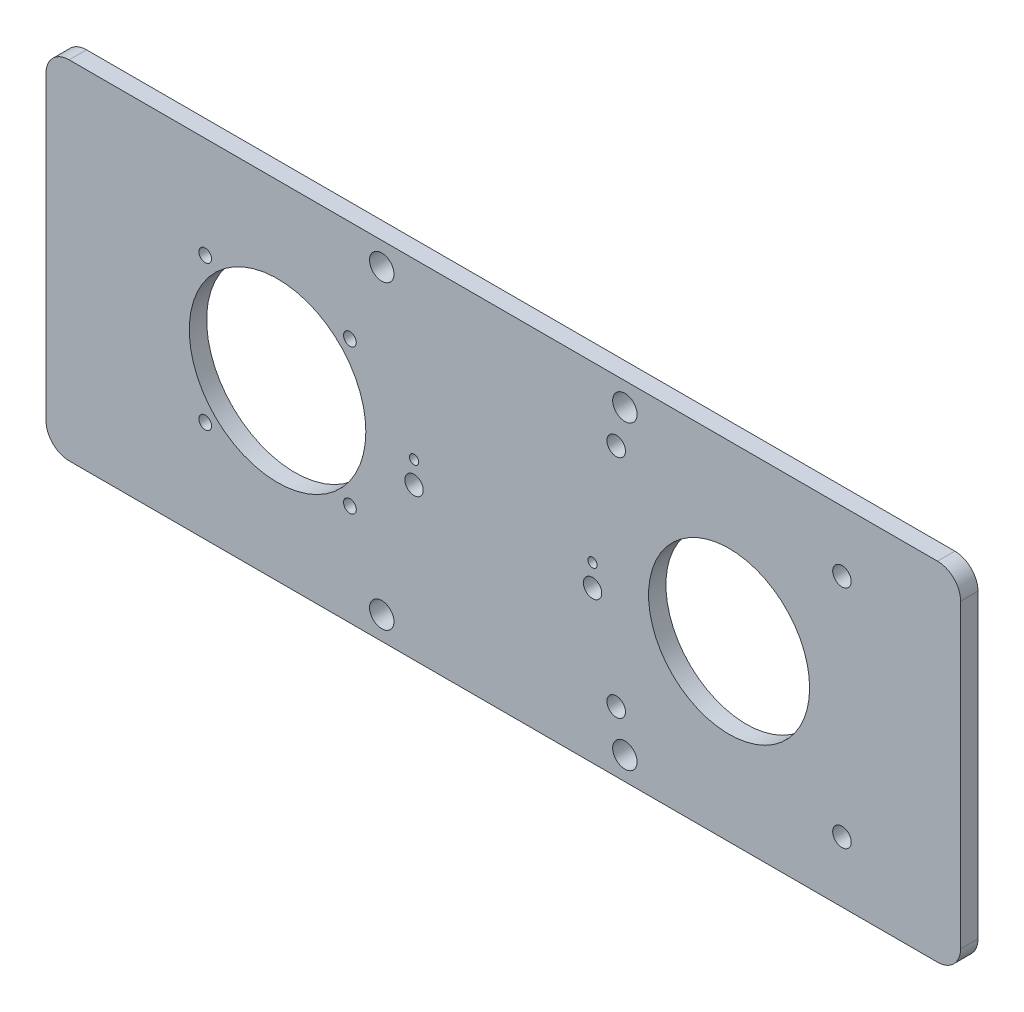
from build123d import *

# Parameters (mm, degrees)
SKETCH3_W             = 158
SKETCH3_H             = 60
SKETCH3_R             = 15.25
SKETCH3_R_2           = 13.91
BOSS_EXTRUDE2_DEPTH   = 3
FILLET1_R             = 4
EVK4_HOLES_D          = 2.2
FLIR_HOLES_D          = 3.2
VN_MOUNT_HOLES_D      = 3.175
VN_REF_HOLES_D        = 1.59
F_1_0MM_DOWEL_HOLE5_D = 4.22


with BuildPart() as part:
    # Sketch3 → Boss-Extrude2 (new body)
    with BuildSketch(Plane.XY):
        with Locations((0, -40)):
            Rectangle(SKETCH3_W, SKETCH3_H)
        with Locations((-39, -40)):
            Circle(SKETCH3_R, mode=Mode.SUBTRACT)
        with Locations((39, -40)):
            Circle(SKETCH3_R_2, mode=Mode.SUBTRACT)
    extrude(amount=-BOSS_EXTRUDE2_DEPTH)

    # Fillet1
    fillet1_edges = [part.edges().sort_by_distance(p)[0] for p in [
        (-79, -70, -1.5),
        (79, -70, -1.5),
        (-79, -10, -1.5),
        (79, -10, -1.5),
    ]]
    fillet(fillet1_edges, radius=FILLET1_R)

    # EVK4-Holes (through all)
    with Locations(Plane.XY):
        with Locations((-51.5, -27.5), (-26.5, -27.5), (-26.5, -52.5), (-51.5, -52.5)):
            Hole(EVK4_HOLES_D / 2)

    # FLIR-Holes (through all)
    with Locations(Plane.XY):
        with Locations((19.5, -20.5), (58.5, -20.5), (58.5, -59.5), (19.5, -59.5)):
            Hole(FLIR_HOLES_D / 2)

    # VN-Mount-Holes (through all)
    with Locations(Plane.XY):
        with Locations((-15.42, -43.81), (15.4159, -43.81)):
            Hole(VN_MOUNT_HOLES_D / 2)

    # VN-Ref-Holes (through all)
    with Locations(Plane.XY):
        with Locations((-15.42, -40), (15.4159, -40)):
            Hole(VN_REF_HOLES_D / 2)

    # Ø1.0mm Dowel Hole5 (through all)
    with Locations(Plane.XY):
        with Locations((-21, -14), (21, -14), (21, -66), (-21, -66)):
            Hole(F_1_0MM_DOWEL_HOLE5_D / 2)


solid = part.part
